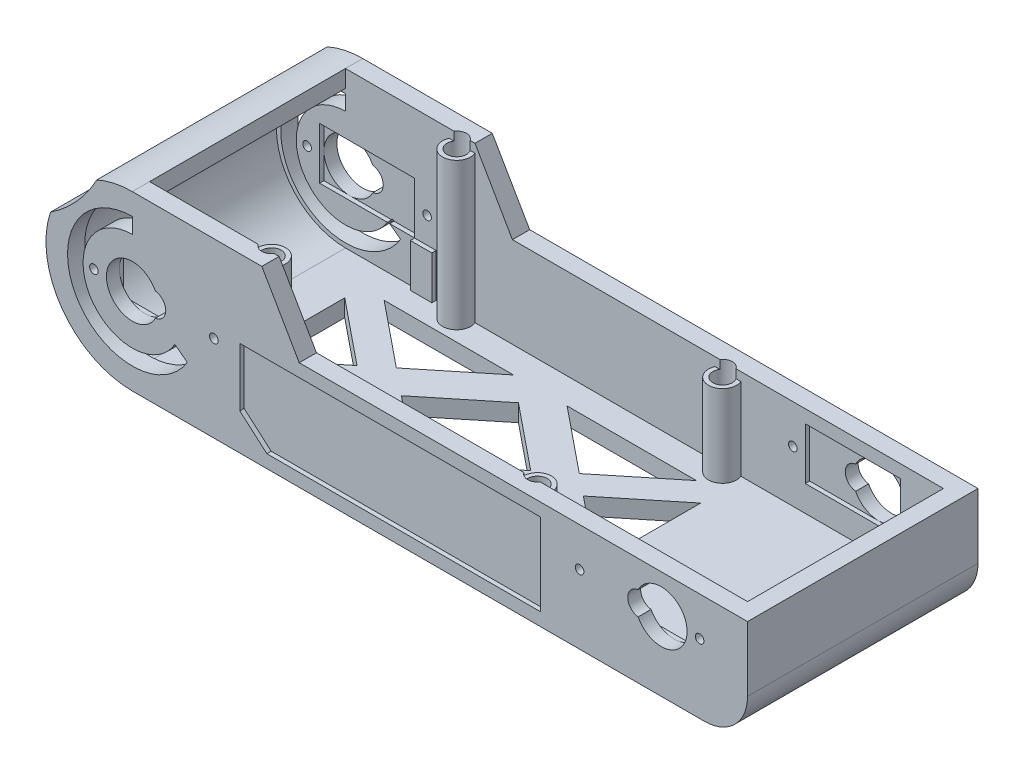
from build123d import *

# Parameters (mm, degrees)
BOSS_EXTRUDE1_DEPTH = 53.38
SHELL4_START        = 4
SHELL4_DEPTH        = 45.38
CUT_EXTRUDE2_REACH  = 154.134
CUT_EXTRUDE3_DEPTH  = 1
CUT_EXTRUDE4_REACH  = 154.134
SKETCH4_R           = 1
BOSS_EXTRUDE3_START = -36
SKETCH8_3_R         = 3.25
BOSS_EXTRUDE3_DEPTH = 34
BOSS_EXTRUDE2_START = -36
SKETCH8_R           = 3.25
BOSS_EXTRUDE2_DEPTH = 19
CUT_EXTRUDE6_DEPTH  = 1
SKETCH15_W          = 5
SKETCH15_H          = 10
BOSS_EXTRUDE6_DEPTH = 1
CUT_EXTRUDE5_REACH  = 155.479
CUT_EXTRUDE8_START  = -30
SKETCH11_R          = 2.25
CUT_EXTRUDE8_DEPTH  = 37
CUT_EXTRUDE10_REACH = 159.339
SKETCH33_W          = 22
SKETCH33_H          = 12
CUT_EXTRUDE12_DEPTH = 1
CUT_EXTRUDE11_REACH = 155.479
SKETCH31_R          = 6
SKETCH31_R_2        = 2.75
SKETCH31_R_3        = 1
SKETCH30_W          = 2
SKETCH30_H          = 10
BOSS_EXTRUDE7_DEPTH = 5
CUT_EXTRUDE13_REACH = 156.21


# Read off the part's stored shape, not the designer's step: Shell4
with BuildPart() as part:
    # Sketch1 → Boss-Extrude1 (new body)
    with BuildSketch(Plane.XY):
        with BuildLine():
            Line((0, 20), (30, 20))
            Line((30, 20), (38.660254038, 5))
            Line((38.660254038, 5), (117.5, 5))
            Line((117.5, 5), (142.5, 5))
            Line((142.5, 5), (142.5, -10))
            ThreePointArc((142.5, -10), (139.571067812, -17.071067812), (132.5, -20))
            Line((132.5, -20), (117.5, -20))
            Line((117.5, -20), (0, -20))
            ThreePointArc((0, -20), (-20, 0), (0, 20))
        make_face()
    extrude(amount=BOSS_EXTRUDE1_DEPTH)

    # Shell4 outline → Shell4 (cut)
    with BuildSketch(Plane.XY.offset(SHELL4_START)):
        with BuildLine():
            Line((30, 20), (0, 20))
            Line((0, 20), (0, 16))
            ThreePointArc((0, 16), (-16, 0), (0, -16))
            Line((0, -16), (132.5, -16))
            ThreePointArc((132.5, -16), (136.742640687, -14.242640687), (138.5, -10))
            Line((138.5, -10), (138.5, 5))
            Line((138.5, 5), (38.660254038, 5))
            Line((38.660254038, 5), (30, 20))
        make_face()
    extrude(amount=SHELL4_DEPTH, mode=Mode.SUBTRACT)

    # Sketch2 → Cut-Extrude2 (cut, up to next)
    with BuildSketch(Plane(origin=(0, 0, 49.38), x_dir=(-1, 0, 0), z_dir=(0, 0, -1)), mode=Mode.PRIVATE) as cut_extrude2_sk1:
        with BuildLine():
            ThreePointArc((-5.34375, -2.72843104), (6, 0), (-5.34375, 2.72843104))
            ThreePointArc((-5.34375, 2.72843104), (-7.75, 0), (-5.34375, -2.72843104))
        make_face()
    cut_extrude2_tool1 = extrude(cut_extrude2_sk1.sketch, amount=-CUT_EXTRUDE2_REACH, mode=Mode.PRIVATE) & part.part
    cut_extrude2 = cut_extrude2_tool1.solids().sort_by_distance((0.414061, 0, 49.38))[0]
    add(cut_extrude2, mode=Mode.SUBTRACT)

    # Sketch3 → Cut-Extrude3 (cut)
    with BuildSketch(Plane(origin=(0, 0, 49.38), x_dir=(-1, 0, 0), z_dir=(0, 0, -1))):
        Polygon((6, 0), (6, 6), (0, 6), (-16, 6), (-16, -6), (6, -6), align=None)
    cut_extrude3 = extrude(amount=-CUT_EXTRUDE3_DEPTH, mode=Mode.SUBTRACT)

    # Sketch4 → Cut-Extrude4 (cut, up to next)
    with BuildSketch(Plane(origin=(0, 0, 49.38), x_dir=(-1, 0, 0), z_dir=(0, 0, -1)), mode=Mode.PRIVATE) as cut_extrude4_sk1:
        with Locations((-18.9, 0)):
            Circle(SKETCH4_R)
    cut_extrude4_tool1 = extrude(cut_extrude4_sk1.sketch, amount=-CUT_EXTRUDE4_REACH, mode=Mode.PRIVATE) & part.part
    # Sketch4 → Cut-Extrude4 (cut, up to next)
    with BuildSketch(Plane(origin=(0, 0, 49.38), x_dir=(-1, 0, 0), z_dir=(0, 0, -1)), mode=Mode.PRIVATE) as cut_extrude4_sk2:
        with Locations((8.9, 0)):
            Circle(SKETCH4_R)
    cut_extrude4_tool2 = extrude(cut_extrude4_sk2.sketch, amount=-CUT_EXTRUDE4_REACH, mode=Mode.PRIVATE) & part.part
    cut_extrude4_1 = cut_extrude4_tool1.solids().sort_by_distance((18.9, 0, 49.38))[0]
    add(cut_extrude4_1, mode=Mode.SUBTRACT)
    cut_extrude4_2 = cut_extrude4_tool2.solids().sort_by_distance((-8.9, 0, 49.38))[0]
    add(cut_extrude4_2, mode=Mode.SUBTRACT)
    cut_extrude4 = cut_extrude4_1 + cut_extrude4_2  # Cut-Extrude4 as one shape, for the pattern or mirror that repeats it

    # Sketch8<3> → Boss-Extrude3 (add)
    with BuildSketch(Plane(origin=(0, 20, 0), x_dir=(1, 0, 0), z_dir=(0, 1, 0)).offset(BOSS_EXTRUDE3_START)):
        with Locations((27, -48.13)):
            Circle(SKETCH8_3_R)
    boss_extrude3 = extrude(amount=BOSS_EXTRUDE3_DEPTH)

    # Sketch8 → Boss-Extrude2 (add)
    with BuildSketch(Plane(origin=(0, 20, 0), x_dir=(1, 0, 0), z_dir=(0, 1, 0)).offset(BOSS_EXTRUDE2_START)):
        with Locations((88.580127019, -48.13)):
            Circle(SKETCH8_R)
    boss_extrude2 = extrude(amount=BOSS_EXTRUDE2_DEPTH)

    # Sketch7 → Cut-Extrude6 (cut)
    with BuildSketch(Plane.XY.offset(53.38)):
        Polygon((24.9, 2), (94.5, 2), (94.5, -17), (31.177304436, -17), (24.9, -11.541099722), align=None)
    cut_extrude6 = extrude(amount=-CUT_EXTRUDE6_DEPTH, mode=Mode.SUBTRACT)

    # Sketch15 → Boss-Extrude6 (add)
    with BuildSketch(Plane(origin=(0, 0, 49.38), x_dir=(-1, 0, 0), z_dir=(0, 0, -1))):
        with Locations((-18.5, -11)):
            Rectangle(SKETCH15_W, SKETCH15_H)
    boss_extrude6 = extrude(amount=BOSS_EXTRUDE6_DEPTH)

    # Sketch6 → Cut-Extrude5 (cut, up to next)
    with BuildSketch(Plane(origin=(0, 0, 0), x_dir=(-1, 0, 0), z_dir=(0, 0, -1)), mode=Mode.PRIVATE) as cut_extrude5_sk1:
        with BuildLine():
            Line((-9.869069779, -5.713995107), (-12.75196804, -7.898563864))
            ThreePointArc((-12.75196804, -7.898563864), (13.104931476, -7.29799774), (0, 15))
            Line((0, 15), (0, 11.403871202))
            ThreePointArc((0, 11.403871202), (9.879522828, -5.695902656), (-9.869069779, -5.713995107))
        make_face()
    cut_extrude5_tool1 = extrude(cut_extrude5_sk1.sketch, amount=-CUT_EXTRUDE5_REACH, mode=Mode.PRIVATE) & part.part
    cut_extrude5 = cut_extrude5_tool1.solids().sort_by_distance((-0.408677, 13.201936, 0))[0]
    add(cut_extrude5, mode=Mode.SUBTRACT)

    # Sketch11 → Cut-Extrude8 (cut)
    with BuildSketch(Plane(origin=(0, 20, 0), x_dir=(1, 0, 0), z_dir=(0, 1, 0)).offset(CUT_EXTRUDE8_START)):
        with Locations(Location((27, -48.13, 0), (0, 0, 213.748988596))):
            Circle(SKETCH11_R)
        with Locations(Location((88.580127019, -48.13, 0), (0, 0, 213.748988596))):
            Circle(SKETCH11_R)
    cut_extrude8 = extrude(amount=CUT_EXTRUDE8_DEPTH, mode=Mode.SUBTRACT)

    # Sketch16 → Cut-Extrude10 (cut, up to next)
    with BuildSketch(Plane.XZ.offset(20), mode=Mode.PRIVATE) as cut_extrude10_sk1:
        Polygon((92.300132803, 14.039480209), (92.300132803, 38.367221242), (77.29915607, 26.203350725), align=None)
    cut_extrude10_tool1 = extrude(cut_extrude10_sk1.sketch, amount=-CUT_EXTRUDE10_REACH, mode=Mode.PRIVATE) & part.part
    # Sketch16 → Cut-Extrude10 (cut, up to next)
    with BuildSketch(Plane.XZ.offset(20), mode=Mode.PRIVATE) as cut_extrude10_sk2:
        Polygon((56.099776869, 43.393331633), (86.067029292, 43.393331633), (71.08340308, 31.243530166), align=None)
    cut_extrude10_tool2 = extrude(cut_extrude10_sk2.sketch, amount=-CUT_EXTRUDE10_REACH, mode=Mode.PRIVATE) & part.part
    # Sketch16 → Cut-Extrude10 (cut, up to next)
    with BuildSketch(Plane.XZ.offset(20), mode=Mode.PRIVATE) as cut_extrude10_sk3:
        Polygon((51.076908189, 15.020825627), (66.108839036, 27.209795964), (51.136179758, 39.350704651), (36.104248911, 27.161734314), align=None)
    cut_extrude10_tool3 = extrude(cut_extrude10_sk3.sketch, amount=-CUT_EXTRUDE10_REACH, mode=Mode.PRIVATE) & part.part
    # Sketch16 → Cut-Extrude10 (cut, up to next)
    with BuildSketch(Plane.XZ.offset(20), mode=Mode.PRIVATE) as cut_extrude10_sk4:
        Polygon((31.070413297, 31.243530166), (16.086787086, 43.393331633), (46.054039509, 43.393331633), align=None)
    cut_extrude10_tool4 = extrude(cut_extrude10_sk4.sketch, amount=-CUT_EXTRUDE10_REACH, mode=Mode.PRIVATE) & part.part
    # Sketch16 → Cut-Extrude10 (cut, up to next)
    with BuildSketch(Plane.XZ.offset(20), mode=Mode.PRIVATE) as cut_extrude10_sk5:
        Polygon((14.96414128, 10.019815057), (29.947767491, 22.169616523), (44.931393703, 10.019815057), align=None)
    cut_extrude10_tool5 = extrude(cut_extrude10_sk5.sketch, amount=-CUT_EXTRUDE10_REACH, mode=Mode.PRIVATE) & part.part
    # Sketch16 → Cut-Extrude10 (cut, up to next)
    with BuildSketch(Plane.XZ.offset(20), mode=Mode.PRIVATE) as cut_extrude10_sk6:
        Polygon((9.912955144, 38.415282892), (24.913931877, 26.251412376), (9.912955144, 14.087541859), align=None)
    cut_extrude10_tool6 = extrude(cut_extrude10_sk6.sketch, amount=-CUT_EXTRUDE10_REACH, mode=Mode.PRIVATE) & part.part
    # Sketch16 → Cut-Extrude10 (cut, up to next)
    with BuildSketch(Plane.XZ.offset(20), mode=Mode.PRIVATE) as cut_extrude10_sk7:
        Polygon((87.308218237, 10.019815057), (72.324592025, 22.169616523), (57.340965814, 10.019815057), align=None)
    cut_extrude10_tool7 = extrude(cut_extrude10_sk7.sketch, amount=-CUT_EXTRUDE10_REACH, mode=Mode.PRIVATE) & part.part
    add(cut_extrude10_tool1.solids().sort_by_distance((87.299807, -20, 26.203351))[0], mode=Mode.SUBTRACT)
    add(cut_extrude10_tool2.solids().sort_by_distance((71.083403, -20, 39.343398))[0], mode=Mode.SUBTRACT)
    add(cut_extrude10_tool3.solids().sort_by_distance((51.106544, -20, 27.185765))[0], mode=Mode.SUBTRACT)
    add(cut_extrude10_tool4.solids().sort_by_distance((31.070413, -20, 39.343398))[0], mode=Mode.SUBTRACT)
    add(cut_extrude10_tool5.solids().sort_by_distance((29.947767, -20, 14.069749))[0], mode=Mode.SUBTRACT)
    add(cut_extrude10_tool6.solids().sort_by_distance((14.913281, -20, 26.251412))[0], mode=Mode.SUBTRACT)
    add(cut_extrude10_tool7.solids().sort_by_distance((72.324592, -20, 14.069749))[0], mode=Mode.SUBTRACT)

    # Sketch33 → Cut-Extrude12 (cut)
    with BuildSketch(Plane(origin=(0, 0, 49.38), x_dir=(-1, 0, 0), z_dir=(0, 0, -1))):
        with Locations((-117.5, -4)):
            Rectangle(SKETCH33_W, SKETCH33_H)
    cut_extrude12 = extrude(amount=-CUT_EXTRUDE12_DEPTH, mode=Mode.SUBTRACT)

    # Sketch31 → Cut-Extrude11 (cut, up to next)
    with BuildSketch(Plane.XY.offset(53.38), mode=Mode.PRIVATE) as cut_extrude11_sk1:
        with Locations((122.5, -4)):
            Circle(SKETCH31_R)
    cut_extrude11_tool1 = extrude(cut_extrude11_sk1.sketch, amount=-CUT_EXTRUDE11_REACH, mode=Mode.PRIVATE) & part.part
    # Sketch31 → Cut-Extrude11 (cut, up to next)
    with BuildSketch(Plane.XY.offset(53.38), mode=Mode.PRIVATE) as cut_extrude11_sk2:
        with Locations((117.5, -4)):
            Circle(SKETCH31_R_2)
    cut_extrude11_tool2 = extrude(cut_extrude11_sk2.sketch, amount=-CUT_EXTRUDE11_REACH, mode=Mode.PRIVATE) & part.part
    # Sketch31 → Cut-Extrude11 (cut, up to next)
    with BuildSketch(Plane.XY.offset(53.38), mode=Mode.PRIVATE) as cut_extrude11_sk3:
        with Locations((103.6, -4)):
            Circle(SKETCH31_R_3)
    cut_extrude11_tool3 = extrude(cut_extrude11_sk3.sketch, amount=-CUT_EXTRUDE11_REACH, mode=Mode.PRIVATE) & part.part
    # Sketch31 → Cut-Extrude11 (cut, up to next)
    with BuildSketch(Plane.XY.offset(53.38), mode=Mode.PRIVATE) as cut_extrude11_sk4:
        with Locations((131.4, -4)):
            Circle(SKETCH31_R_3)
    cut_extrude11_tool4 = extrude(cut_extrude11_sk4.sketch, amount=-CUT_EXTRUDE11_REACH, mode=Mode.PRIVATE) & part.part
    cut_extrude11_1 = cut_extrude11_tool1.solids().sort_by_distance((122.5, -4, 53.38))[0]
    add(cut_extrude11_1, mode=Mode.SUBTRACT)
    cut_extrude11_2 = cut_extrude11_tool2.solids().sort_by_distance((117.5, -4, 53.38))[0]
    add(cut_extrude11_2, mode=Mode.SUBTRACT)
    cut_extrude11_3 = cut_extrude11_tool3.solids().sort_by_distance((103.6, -4, 53.38))[0]
    add(cut_extrude11_3, mode=Mode.SUBTRACT)
    cut_extrude11_4 = cut_extrude11_tool4.solids().sort_by_distance((131.4, -4, 53.38))[0]
    add(cut_extrude11_4, mode=Mode.SUBTRACT)
    cut_extrude11 = cut_extrude11_1 + cut_extrude11_2 + cut_extrude11_3 + cut_extrude11_4  # Cut-Extrude11 as one shape, for the pattern or mirror that repeats it

    # Mirror3: Cut-Extrude2, Cut-Extrude3, Cut-Extrude4, Boss-Extrude3, Boss-Extrude2, Cut-Extrude6, Boss-Extrude6, Cut-Extrude5, Cut-Extrude8, Cut-Extrude12, Cut-Extrude11 across plane
    add(cut_extrude2.mirror(Plane.XY.offset(26.69)), mode=Mode.SUBTRACT)
    add(cut_extrude3.mirror(Plane.XY.offset(26.69)), mode=Mode.SUBTRACT)
    add(cut_extrude4.mirror(Plane.XY.offset(26.69)), mode=Mode.SUBTRACT)
    add(boss_extrude3.mirror(Plane.XY.offset(26.69)))
    add(boss_extrude2.mirror(Plane.XY.offset(26.69)))
    add(cut_extrude6.mirror(Plane.XY.offset(26.69)), mode=Mode.SUBTRACT)
    add(boss_extrude6.mirror(Plane.XY.offset(26.69)))
    add(cut_extrude5.mirror(Plane.XY.offset(26.69)), mode=Mode.SUBTRACT)
    add(cut_extrude8.mirror(Plane.XY.offset(26.69)), mode=Mode.SUBTRACT)
    add(cut_extrude12.mirror(Plane.XY.offset(26.69)), mode=Mode.SUBTRACT)
    add(cut_extrude11.mirror(Plane.XY.offset(26.69)), mode=Mode.SUBTRACT)

    # Sketch30 → Boss-Extrude7 (add)
    with BuildSketch(Plane.XZ.offset(20)):
        with Locations((117.5, 26.69)):
            Rectangle(SKETCH30_W, SKETCH30_H)
    extrude(amount=BOSS_EXTRUDE7_DEPTH)

    # Sketch35 → Cut-Extrude13 (cut, up to next)
    with BuildSketch(Plane(origin=(0, 0, 0), x_dir=(-1, 0, 0), z_dir=(0, 0, -1)), mode=Mode.PRIVATE) as cut_extrude13_sk1:
        with BuildLine():
            Line((8.23672098, 18.22515919), (18.948526501, 18.571081562))
            Line((18.948526501, 18.571081562), (18.948526501, 6.399479936))
            ThreePointArc((18.948526501, 6.399479936), (12.854967599, 11.644144065), (8.23672098, 18.22515919))
        make_face()
    cut_extrude13_tool1 = extrude(cut_extrude13_sk1.sketch, amount=-CUT_EXTRUDE13_REACH, mode=Mode.PRIVATE) & part.part
    add(cut_extrude13_tool1.solids().sort_by_distance((-15.086438, 14.068826, 0))[0], mode=Mode.SUBTRACT)


solid = part.part
